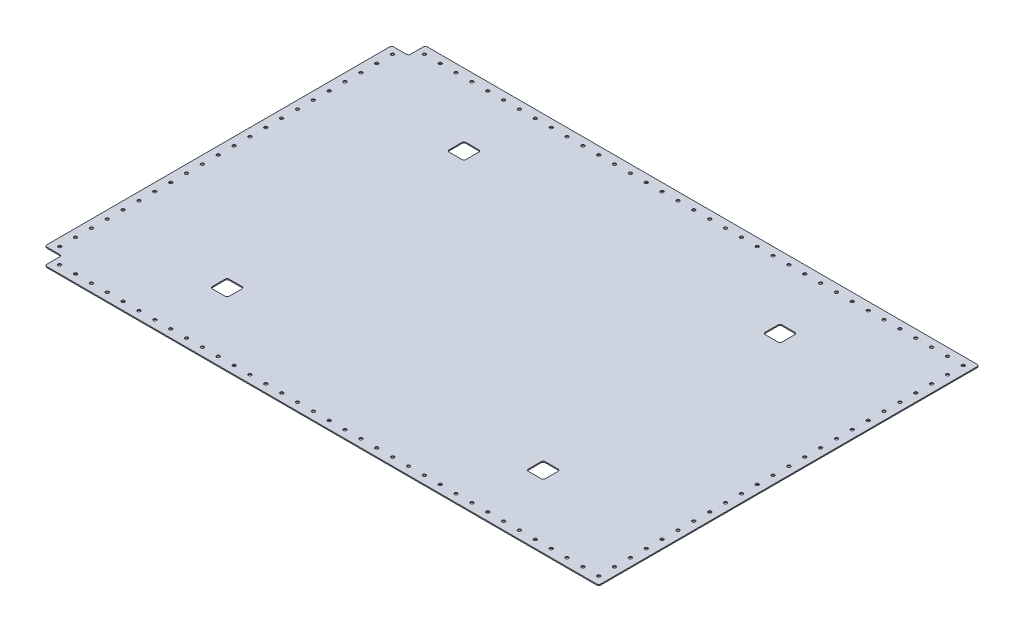
from build123d import *

# Parameters (mm, degrees)
BOSS_EXTRUDE1_DEPTH = 1.5875
SKETCH2_R           = 2.4892
CUT_EXTRUDE1_DEPTH  = 550.48830757
LPATTERN1_COUNT     = 24
LPATTERN1_PITCH     = 25.4
LPATTERN1_COL_COUNT = 35
LPATTERN1_COL_PITCH = 25.4
LPATTERN2_OUTLINE_R = 2.4892
LPATTERN2_DEPTH     = 1.5875
SKETCH3_R           = 2.4892
CUT_EXTRUDE2_DEPTH  = 550.48830757
LPATTERN3_COUNT     = 22
LPATTERN3_PITCH     = 25.4
SKETCH4_W           = 26.9875
SKETCH4_H           = 26.9875
CUT_EXTRUDE3_DEPTH  = 550.48830757
FILLET1_R           = 3.175


# Read off the part's stored shape, not the designer's step: LPattern2
with BuildPart() as part:
    # Sketch1 → Boss-Extrude1 (new body)
    with BuildSketch(Plane(origin=(0, 0, 0), x_dir=(1, 0, 0), z_dir=(0, 1, 0))):
        Polygon((-430.2125, -304.8), (457.2, -304.8), (457.2, 304.8), (-430.2125, 304.8), (-430.2125, 277.8125), (-457.2, 277.8125), (-457.2, -277.8125), (-430.2125, -277.8125), align=None)
    extrude(amount=BOSS_EXTRUDE1_DEPTH)

    # Sketch2 → Cut-Extrude1 (cut, through all)
    with BuildSketch(Plane(origin=(0, 1.5875, 0), x_dir=(1, 0, 0), z_dir=(0, 1, 0))):
        with Locations(Location((444.5, 292.1, 0), (0, 0, 270))):
            Circle(SKETCH2_R)
    cut_extrude1 = extrude(amount=-CUT_EXTRUDE1_DEPTH, mode=Mode.SUBTRACT)

    # LPattern1: Cut-Extrude1 ×24
    with Locations(*[(0, 0, i * LPATTERN1_PITCH) for i in range(1, LPATTERN1_COUNT)]):
        add(cut_extrude1, mode=Mode.SUBTRACT)

    # LPattern1 col: Cut-Extrude1 ×35
    with Locations(*[(-i * LPATTERN1_COL_PITCH, 0, 0) for i in range(1, LPATTERN1_COL_COUNT)]):
        add(cut_extrude1, mode=Mode.SUBTRACT)

    # LPattern2 outline → LPattern2 (cut)
    with BuildSketch(Plane(origin=(0, 0, 0), x_dir=(1, 0, 0), z_dir=(0, 1, 0))):
        with Locations((-419.1, -292.1)):
            Circle(LPATTERN2_OUTLINE_R)
        with Locations((-393.7, -292.1)):
            Circle(LPATTERN2_OUTLINE_R)
        with Locations((-368.3, -292.1)):
            Circle(LPATTERN2_OUTLINE_R)
        with Locations((-342.9, -292.1)):
            Circle(LPATTERN2_OUTLINE_R)
        with Locations((-317.5, -292.1)):
            Circle(LPATTERN2_OUTLINE_R)
        with Locations((-292.1, -292.1)):
            Circle(LPATTERN2_OUTLINE_R)
        with Locations((-266.7, -292.1)):
            Circle(LPATTERN2_OUTLINE_R)
        with Locations((-241.3, -292.1)):
            Circle(LPATTERN2_OUTLINE_R)
        with Locations((-215.9, -292.1)):
            Circle(LPATTERN2_OUTLINE_R)
        with Locations((-190.5, -292.1)):
            Circle(LPATTERN2_OUTLINE_R)
        with Locations((-165.1, -292.1)):
            Circle(LPATTERN2_OUTLINE_R)
        with Locations((-139.7, -292.1)):
            Circle(LPATTERN2_OUTLINE_R)
        with Locations((-114.3, -292.1)):
            Circle(LPATTERN2_OUTLINE_R)
        with Locations((-88.9, -292.1)):
            Circle(LPATTERN2_OUTLINE_R)
        with Locations((-63.5, -292.1)):
            Circle(LPATTERN2_OUTLINE_R)
        with Locations((-38.1, -292.1)):
            Circle(LPATTERN2_OUTLINE_R)
        with Locations((-12.7, -292.1)):
            Circle(LPATTERN2_OUTLINE_R)
        with Locations((12.7, -292.1)):
            Circle(LPATTERN2_OUTLINE_R)
        with Locations((38.1, -292.1)):
            Circle(LPATTERN2_OUTLINE_R)
        with Locations((63.5, -292.1)):
            Circle(LPATTERN2_OUTLINE_R)
        with Locations((88.9, -292.1)):
            Circle(LPATTERN2_OUTLINE_R)
        with Locations((114.3, -292.1)):
            Circle(LPATTERN2_OUTLINE_R)
        with Locations((139.7, -292.1)):
            Circle(LPATTERN2_OUTLINE_R)
        with Locations((165.1, -292.1)):
            Circle(LPATTERN2_OUTLINE_R)
        with Locations((190.5, -292.1)):
            Circle(LPATTERN2_OUTLINE_R)
        with Locations((215.9, -292.1)):
            Circle(LPATTERN2_OUTLINE_R)
        with Locations((241.3, -292.1)):
            Circle(LPATTERN2_OUTLINE_R)
        with Locations((266.7, -292.1)):
            Circle(LPATTERN2_OUTLINE_R)
        with Locations((292.1, -292.1)):
            Circle(LPATTERN2_OUTLINE_R)
        with Locations((317.5, -292.1)):
            Circle(LPATTERN2_OUTLINE_R)
        with Locations((342.9, -292.1)):
            Circle(LPATTERN2_OUTLINE_R)
        with Locations((368.3, -292.1)):
            Circle(LPATTERN2_OUTLINE_R)
        with Locations((393.7, -292.1)):
            Circle(LPATTERN2_OUTLINE_R)
        with Locations((419.1, -292.1)):
            Circle(LPATTERN2_OUTLINE_R)
    extrude(amount=LPATTERN2_DEPTH, mode=Mode.SUBTRACT)

    # Sketch3 → Cut-Extrude2 (cut, through all)
    with BuildSketch(Plane(origin=(0, 1.5875, 0), x_dir=(1, 0, 0), z_dir=(0, 1, 0))):
        with Locations(Location((-444.5, 266.7, 0), (0, 0, 270))):
            Circle(SKETCH3_R)
    cut_extrude2 = extrude(amount=-CUT_EXTRUDE2_DEPTH, mode=Mode.SUBTRACT)

    # LPattern3: Cut-Extrude2 ×22
    with Locations(*[(0, 0, i * LPATTERN3_PITCH) for i in range(1, LPATTERN3_COUNT)]):
        add(cut_extrude2, mode=Mode.SUBTRACT)

    # Sketch4 → Cut-Extrude3 (cut, through all)
    with BuildSketch(Plane(origin=(0, 1.5875, 0), x_dir=(1, 0, 0), z_dir=(0, 1, 0))):
        with Locations((-253.20625, 189.70625)):
            Rectangle(SKETCH4_W, SKETCH4_H)
        with Locations((-253.20625, -189.70625)):
            Rectangle(SKETCH4_W, SKETCH4_H)
        with Locations((253.20625, 189.70625)):
            Rectangle(SKETCH4_W, SKETCH4_H)
        with Locations((253.20625, -189.70625)):
            Rectangle(SKETCH4_W, SKETCH4_H)
    extrude(amount=-CUT_EXTRUDE3_DEPTH, mode=Mode.SUBTRACT)

    # Fillet1
    fillet1_edges = [part.edges().sort_by_distance(p)[0] for p in [
        (-430.2125, 0.79375, 277.8125),
        (-457.2, 0.79375, 277.8125),
        (-457.2, 0.79375, -277.8125),
        (-430.2125, 0.79375, -277.8125),
        (-430.2125, 0.79375, -304.8),
        (457.2, 0.79375, -304.8),
        (457.2, 0.79375, 304.8),
        (-430.2125, 0.79375, 304.8),
        (-266.7, 0.79375, 203.2),
        (-266.7, 0.79375, 176.2125),
        (-239.7125, 0.79375, 176.2125),
        (-239.7125, 0.79375, 203.2),
        (239.7125, 0.79375, -176.2125),
        (239.7125, 0.79375, -203.2),
        (266.7, 0.79375, -203.2),
        (266.7, 0.79375, -176.2125),
        (239.7125, 0.79375, 203.2),
        (239.7125, 0.79375, 176.2125),
        (266.7, 0.79375, 176.2125),
        (266.7, 0.79375, 203.2),
        (-266.7, 0.79375, -176.2125),
        (-266.7, 0.79375, -203.2),
        (-239.7125, 0.79375, -203.2),
        (-239.7125, 0.79375, -176.2125),
    ]]
    fillet(fillet1_edges, radius=FILLET1_R)


solid = part.part
